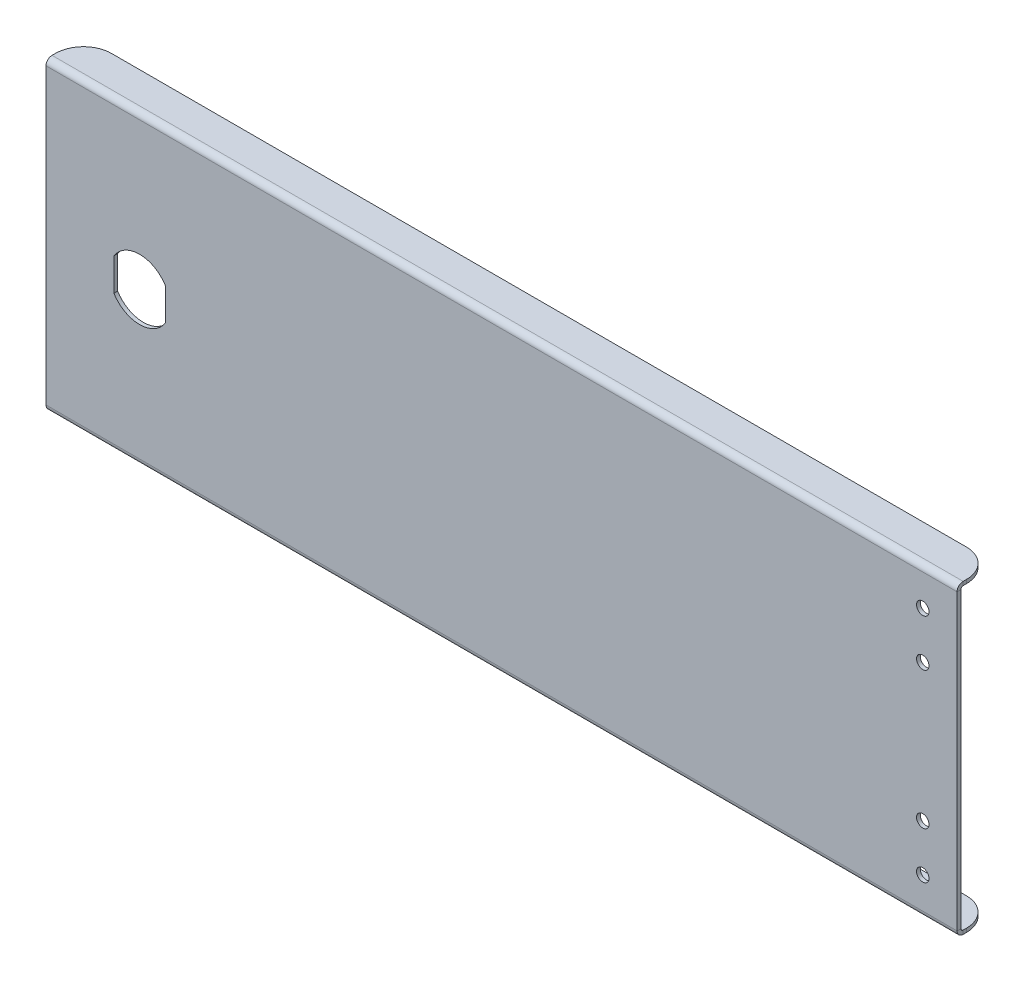
from build123d import *

# Parameters (mm, degrees)
SKETCH_1_W                         = 292
SKETCH_1_H                         = 98
SKETCH_1_R                         = 2
SM_BASE_FLANGE_1_DEPTH             = 1.2
SM_EDGE_FLANGE_1_STRIP_W           = 6.2732
SM_EDGE_FLANGE_1_STRIP_H           = 1.2
SM_EDGE_FLANGE_1_STRIP_CUT_DEPTH   = 292
SM_EDGE_FLANGE_1_STRIP_2_W         = 6.2732
SM_EDGE_FLANGE_1_STRIP_2_H         = 1.2
SM_EDGE_FLANGE_1_STRIP_CUT_2_DEPTH = 292
SM_EDGE_FLANGE_1_DEPTH             = 292
SM_EDGE_FLANGE_1_BEND_DEPTH        = 292
CUT_EXTRUDE_1_DEPTH                = 309.240166104


# Sheet-metal steps are written as plain solids
with BuildPart() as part:
    # Sketch 1 → Базовая кромка1 (new body)
    with BuildSketch(Plane.XY):
        with Locations((146, 49)):
            Rectangle(SKETCH_1_W, SKETCH_1_H)
        with Locations((281, 86)):
            Circle(SKETCH_1_R, mode=Mode.SUBTRACT)
        with Locations((281, 71)):
            Circle(SKETCH_1_R, mode=Mode.SUBTRACT)
        with Locations((281, 27)):
            Circle(SKETCH_1_R, mode=Mode.SUBTRACT)
        with Locations((281, 12)):
            Circle(SKETCH_1_R, mode=Mode.SUBTRACT)
        with BuildLine():
            Line((21.75, 54.196152423), (21.75, 43.803847577))
            ThreePointArc((21.75, 43.803847577), (30, 39.25), (38.25, 43.803847577))
            Line((38.25, 43.803847577), (38.25, 54.196152423))
            ThreePointArc((38.25, 54.196152423), (30, 58.75), (21.75, 54.196152423))
        make_face(mode=Mode.SUBTRACT)
    extrude(amount=-SM_BASE_FLANGE_1_DEPTH)

    # Ребро-кромка1 strip (across the edge) → Ребро-кромка1 strip cut (cut)
    with BuildSketch(Plane(origin=(0, 98, -1.2), x_dir=(0, -1, 0), z_dir=(1, 0, 0))):
        with Locations((-1.2, -0.6)):
            Rectangle(SM_EDGE_FLANGE_1_STRIP_W, SM_EDGE_FLANGE_1_STRIP_H)
    extrude(amount=SM_EDGE_FLANGE_1_STRIP_CUT_DEPTH, mode=Mode.SUBTRACT)

    # Ребро-кромка1 strip 2 (across the edge) → Ребро-кромка1 strip cut 2 (cut)
    with BuildSketch(Plane(origin=(292, 0, -1.2), x_dir=(0, 1, 0), z_dir=(-1, 0, 0))):
        with Locations((-1.2, -0.6)):
            Rectangle(SM_EDGE_FLANGE_1_STRIP_2_W, SM_EDGE_FLANGE_1_STRIP_2_H)
    extrude(amount=SM_EDGE_FLANGE_1_STRIP_CUT_2_DEPTH, mode=Mode.SUBTRACT)

    # Ребро-кромка1 section (across the edge) → Ребро-кромка1 (add)
    with BuildSketch(Plane(origin=(0, 98, -1.2), x_dir=(0, -1, 0), z_dir=(1, 0, 0))):
        with BuildLine():
            Line((0, 0.7366), (0, 10.8))
            Line((0, 10.8), (1.2, 10.8))
            Line((1.2, 10.8), (1.2, 0.7366))
            ThreePointArc((1.2, 0.7366), (1.415745145, 0.215745145), (1.9366, 0))
            Line((1.9366, 0), (1.9366, -1.2))
            ThreePointArc((1.9366, -1.2), (0.567217008, -0.632782992), (0, 0.7366))
        make_face()
    extrude(amount=SM_EDGE_FLANGE_1_DEPTH)

    # Ребро-кромка1 section 2 (across the edge) → Ребро-кромка1 bend (add)
    with BuildSketch(Plane(origin=(292, 0, -1.2), x_dir=(0, 1, 0), z_dir=(-1, 0, 0))):
        with BuildLine():
            Line((0, 0.7366), (0, 10.8))
            Line((0, 10.8), (1.2, 10.8))
            Line((1.2, 10.8), (1.2, 0.7366))
            ThreePointArc((1.2, 0.7366), (1.415745145, 0.215745145), (1.9366, 0))
            Line((1.9366, 0), (1.9366, -1.2))
            ThreePointArc((1.9366, -1.2), (0.567217008, -0.632782992), (0, 0.7366))
        make_face()
    extrude(amount=SM_EDGE_FLANGE_1_BEND_DEPTH)

    # Эскиз12 → Вырез-Вытянуть1 (cut, through all)
    with BuildSketch(Plane(origin=(0, 98, 0), x_dir=(1, 0, 0), z_dir=(0, 1, 0))):
        with BuildLine():
            Line((9, 12), (0, 12))
            Line((0, 12), (0, 3))
            ThreePointArc((0, 3), (2.636038969, 9.363961031), (9, 12))
        make_face()
        with BuildLine():
            Line((283, 12), (292, 12))
            Line((292, 12), (292, 3))
            ThreePointArc((292, 3), (289.363961031, 9.363961031), (283, 12))
        make_face()
    extrude(amount=-CUT_EXTRUDE_1_DEPTH, mode=Mode.SUBTRACT)


solid = part.part
